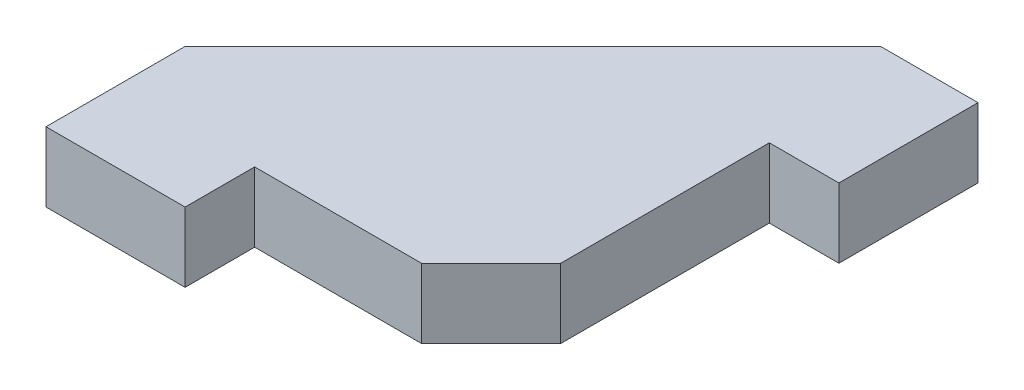
from build123d import *

# Parameters (mm, degrees)
BOSS_EXTRUDE1_DEPTH = 5


with BuildPart() as part:
    # Sketch1 → Boss-Extrude1 (new body)
    with BuildSketch(Plane(origin=(0, 0, 0), x_dir=(1, 0, 0), z_dir=(0, 1, 0))):
        Polygon((0, 0), (0, 10), (25, 35), (32, 35), (32, 25), (27, 25), (27, 10), (22, 5), (10, 5), (10, 0), align=None)
    extrude(amount=BOSS_EXTRUDE1_DEPTH)


solid = part.part
